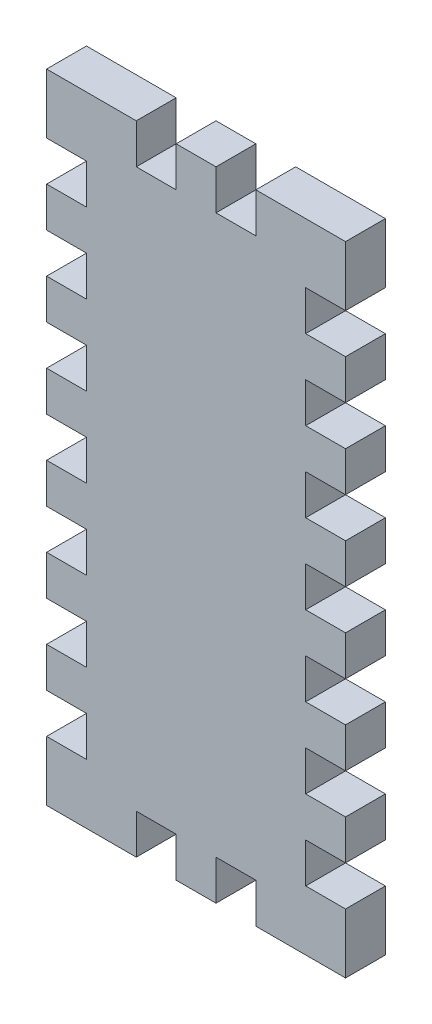
from build123d import *

# Parameters (mm, degrees)
SKETCH1_W            = 47.625
SKETCH1_H            = 101.6
BOSS_EXTRUDE1_DEPTH  = 6.35
SKETCH4_W            = 12.7
SKETCH4_H            = 6.35
CUT_EXTRUDE1_DEPTH   = 177.991271514
LPATTERN1_COUNT      = 4
LPATTERN1_PITCH      = 12.7
LPATTERN1_COUNT_DIR2 = 4
LPATTERN1_PITCH_DIR2 = 12.7
SKETCH3_W            = 6.35
SKETCH3_H            = 12.7
CUT_EXTRUDE2_DEPTH   = 177.991271514


with BuildPart() as part:
    # Sketch1 → Boss-Extrude1 (new body)
    with BuildSketch(Plane.XY):
        with Locations((-23.8125, -119.54508231)):
            Rectangle(SKETCH1_W, SKETCH1_H)
    extrude(amount=-BOSS_EXTRUDE1_DEPTH)

    # Sketch4 → Cut-Extrude1 (cut, through all)
    with BuildSketch(Plane.XY):
        with Locations((0, -119.54508231)):
            Rectangle(SKETCH4_W, SKETCH4_H)
        with Locations((-47.625, -119.54508231)):
            Rectangle(SKETCH4_W, SKETCH4_H)
    cut_extrude1 = extrude(amount=-CUT_EXTRUDE1_DEPTH, mode=Mode.SUBTRACT)

    # LPattern1: Cut-Extrude1 4 × 4
    with Locations(*[Vector(0, -1, 0) * (i * LPATTERN1_PITCH) + Vector(0, 1, 0) * (j * LPATTERN1_PITCH_DIR2) for i in range(LPATTERN1_COUNT) for j in range(LPATTERN1_COUNT_DIR2) if (i, j) != (0, 0)]):
        add(cut_extrude1, mode=Mode.SUBTRACT)

    # Sketch3 → Cut-Extrude2 (cut, through all)
    with BuildSketch(Plane.XY):
        with Locations((-17.4625, -68.74508231)):
            Rectangle(SKETCH3_W, SKETCH3_H)
        with Locations((-30.1625, -68.74508231)):
            Rectangle(SKETCH3_W, SKETCH3_H)
        with Locations((-30.1625, -170.34508231)):
            Rectangle(SKETCH3_W, SKETCH3_H)
        with Locations((-17.4625, -170.34508231)):
            Rectangle(SKETCH3_W, SKETCH3_H)
    extrude(amount=-CUT_EXTRUDE2_DEPTH, mode=Mode.SUBTRACT)


solid = part.part
